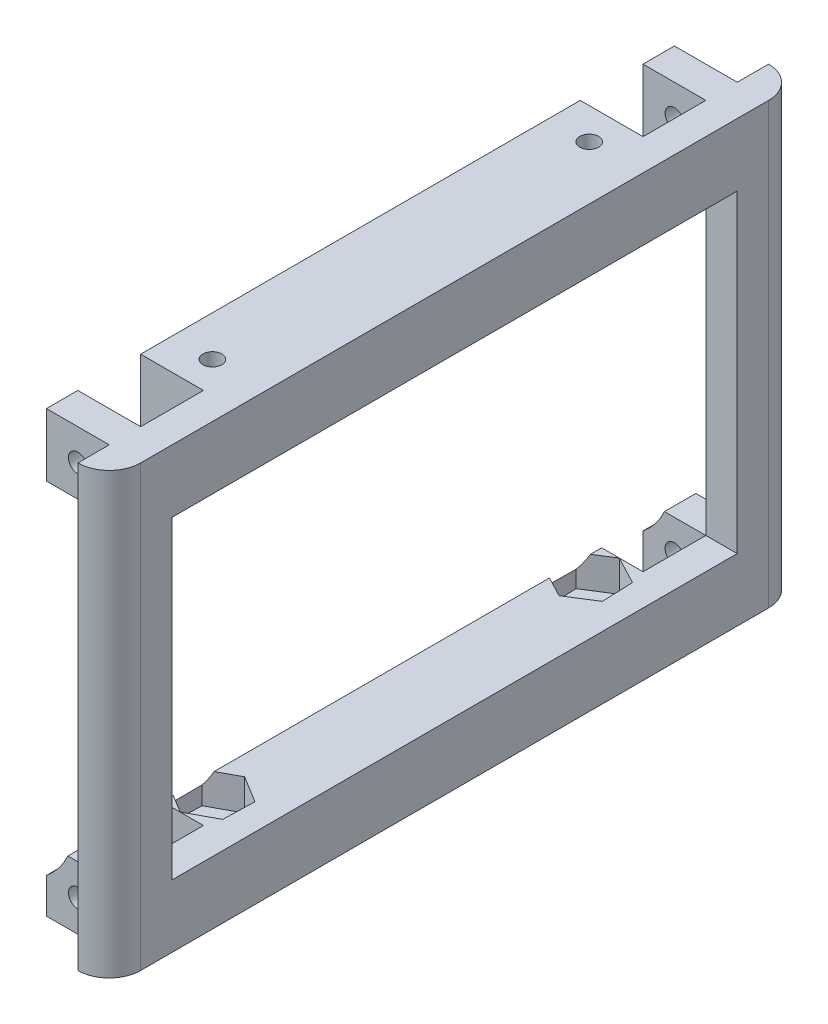
from build123d import *

# Parameters (mm, degrees)
SKETCH1_W               = 110
SKETCH1_H               = 70
BOSS_EXTRUDE1_DEPTH     = 5
FILLET2_R               = 5
FILLET3_R               = 5
SKETCH2_W               = 5
SKETCH2_H               = 10
BOSS_EXTRUDE2_DEPTH     = 10
SKETCH3_R               = 1.5
CUT_EXTRUDE1_DEPTH      = 122
SKETCH4_W               = 70
SKETCH4_H               = 10
BOSS_EXTRUDE3_DEPTH     = 10
SKETCH5_R               = 11.5
CUT_EXTRUDE2_DEPTH      = 105
SKETCH6_R               = 1.5
CUT_EXTRUDE3_DEPTH      = 105
CUT_EXTRUDE4_DEPTH      = 55
CUT_EXTRUDE4_DEPTH_BACK = 5
SKETCH9_W               = 90
SKETCH9_H               = 50
CUT_EXTRUDE5_DEPTH      = 55
SKETCH10_R              = 12
CUT_EXTRUDE6_DEPTH      = 109


with BuildPart() as part:
    # Sketch1 → Boss-Extrude1 (new body)
    with BuildSketch(Plane(origin=(0, 0, 0), x_dir=(0, 0, -1), z_dir=(1, 0, 0))):
        with Locations((55, 35)):
            Rectangle(SKETCH1_W, SKETCH1_H)
    extrude(amount=BOSS_EXTRUDE1_DEPTH)

    # Fillet2
    fillet2_edges = [part.edges().sort_by_distance(p)[0] for p in [
        (5, 35, 0),
    ]]
    fillet(fillet2_edges, radius=FILLET2_R - 0.0001)  # a hair under: the kernel refuses the full size

    # Fillet3
    fillet3_edges = [part.edges().sort_by_distance(p)[0] for p in [
        (5, 35, -110),
    ]]
    fillet(fillet3_edges, radius=FILLET3_R - 0.0001)  # a hair under: the kernel refuses the full size

    # Sketch2 → Boss-Extrude2 (add)
    with BuildSketch(Plane.ZY):
        with Locations((-102.5, 65)):
            Rectangle(SKETCH2_W, SKETCH2_H)
        with Locations((-102.5, 5)):
            Rectangle(SKETCH2_W, SKETCH2_H)
        with Locations((-7.5, 5)):
            Rectangle(SKETCH2_W, SKETCH2_H)
        with Locations((-7.5, 65)):
            Rectangle(SKETCH2_W, SKETCH2_H)
    extrude(amount=BOSS_EXTRUDE2_DEPTH)

    # Sketch3 → Cut-Extrude1 (cut)
    with BuildSketch(Plane.XY.offset(-5)):
        with Locations((-5, 65)):
            Circle(SKETCH3_R)
        with Locations((-5, 5)):
            Circle(SKETCH3_R)
    extrude(amount=-CUT_EXTRUDE1_DEPTH, mode=Mode.SUBTRACT)

    # Sketch4 → Boss-Extrude3 (add)
    with BuildSketch(Plane.ZY):
        with Locations((-55, 65)):
            Rectangle(SKETCH4_W, SKETCH4_H)
        with Locations((-55, 5)):
            Rectangle(SKETCH4_W, SKETCH4_H)
    extrude(amount=BOSS_EXTRUDE3_DEPTH)

    # Sketch5 → Cut-Extrude2 (cut)
    with BuildSketch(Plane.XY.offset(-5)):
        with Locations((-17.5, 15)):
            Circle(SKETCH5_R)
    extrude(amount=-CUT_EXTRUDE2_DEPTH, mode=Mode.SUBTRACT)

    # Sketch6 → Cut-Extrude3 (cut)
    with BuildSketch(Plane.XZ):
        with Locations(Location((-3.573842411, -25, 0), (0, 0, 270))):
            Circle(SKETCH6_R)
        with Locations(Location((-3.573842411, -85, 0), (0, 0, 270))):
            Circle(SKETCH6_R)
    extrude(amount=-CUT_EXTRUDE3_DEPTH, mode=Mode.SUBTRACT)

    # Sketch7 → Cut-Extrude4 (cut, two sides: drawn at the far end of the back side and taken through both)
    with BuildSketch(Plane.XZ.offset(-60).offset(-CUT_EXTRUDE4_DEPTH_BACK)):
        Polygon((0.824714328, -27.377540454), (0.68444639, -22.37950835), (-3.71411035, -20.001967897), (-7.972399151, -22.622459546), (-7.832131212, -27.62049165), (-3.433574473, -29.998032103), align=None)
        Polygon((0.654912484, -87.66788906), (0.850994737, -82.671735365), (-3.377760158, -80.003846304), (-7.802597306, -82.33211094), (-7.99867956, -87.328264635), (-3.769924665, -89.996153696), align=None)
    extrude(amount=CUT_EXTRUDE4_DEPTH + CUT_EXTRUDE4_DEPTH_BACK, mode=Mode.SUBTRACT)

    # Sketch9 → Cut-Extrude5 (cut)
    with BuildSketch(Plane.ZY):
        with Locations((-55, 35)):
            Rectangle(SKETCH9_W, SKETCH9_H)
    extrude(amount=-CUT_EXTRUDE5_DEPTH, mode=Mode.SUBTRACT)

    # Sketch10 → Cut-Extrude6 (cut)
    with BuildSketch(Plane.XY.offset(-5)):
        with Locations((-17.5, 15)):
            Circle(SKETCH10_R)
    extrude(amount=-CUT_EXTRUDE6_DEPTH, mode=Mode.SUBTRACT)


solid = part.part
